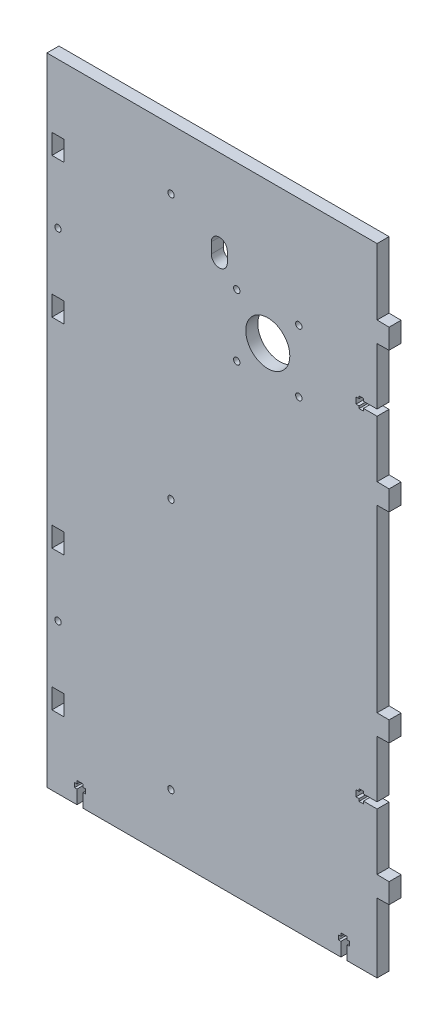
from build123d import *

# Parameters (mm, degrees)
SKETCH_1_R      = 1.6
SKETCH_1_R_2    = 11
SKETCH_1_W      = 6.1
SKETCH_1_H      = 10
EXTRUDE_1_DEPTH = 6


with BuildPart() as part:
    # Эскиз1 → Бобышка-Вытянуть1 (new body)
    with BuildSketch(Plane.XY):
        Polygon((1078.719864828, 623.038519), (1084.719864828, 623.138519), (1084.719864828, 633.138519), (1078.719864828, 633.238519), (1078.719864828, 723.038519), (1084.719864828, 723.138519), (1084.719864828, 733.138519), (1078.719864828, 733.238519), (1078.719864828, 761.588519), (1071.919864828, 761.588519), (1071.919864828, 760.388519), (1069.719864828, 760.388519), (1069.719864828, 761.588519), (1068.219864828, 761.588519), (1068.219864828, 764.688519), (1069.719864828, 764.688519), (1069.719864828, 765.888519), (1071.919864828, 765.888519), (1071.919864828, 764.688519), (1078.719864828, 764.688519), (1078.719864828, 793.038519), (1084.719864828, 793.138519), (1084.719864828, 803.138519), (1078.719864828, 803.238519), (1078.719864828, 836.338519), (978.719864828, 836.338519), (913.719864828, 836.338519), (913.719864828, 518.436195), (928.719864828, 518.436195), (928.719864828, 525.236195), (927.519864828, 525.236195), (927.519864828, 527.436195), (928.719864828, 527.436195), (928.719864828, 528.936195), (931.819864828, 528.936195), (931.819864828, 527.436195), (933.019864828, 527.436195), (933.019864828, 525.236195), (931.819864828, 525.236195), (931.819864828, 518.436195), (978.719864828, 518.436195), (1060.619864828, 518.436195), (1060.619864828, 525.236195), (1059.419864828, 525.236195), (1059.419864828, 527.436195), (1060.619864828, 527.436195), (1060.619864828, 528.936195), (1063.719864828, 528.936195), (1063.719864828, 527.436195), (1064.919864828, 527.436195), (1064.919864828, 525.236195), (1063.719864828, 525.236195), (1063.719864828, 518.436195), (1078.719864828, 518.436195), (1078.719864828, 553.038519), (1084.719864828, 553.138519), (1084.719864828, 563.138519), (1078.719864828, 563.238519), (1078.719864828, 591.588519), (1071.919864828, 591.588519), (1071.919864828, 590.388519), (1069.719864828, 590.388519), (1069.719864828, 591.588519), (1068.219864828, 591.588519), (1068.219864828, 594.688519), (1069.719864828, 594.688519), (1069.719864828, 595.888519), (1071.919864828, 595.888519), (1071.919864828, 594.688519), (1078.719864828, 594.688519), align=None)
        with Locations((919.269864828, 593.238519)):
            Circle(SKETCH_1_R, mode=Mode.SUBTRACT)
        with Locations((919.269864828, 763.238519)):
            Circle(SKETCH_1_R, mode=Mode.SUBTRACT)
        with Locations((975.719864828, 806.338519)):
            Circle(SKETCH_1_R, mode=Mode.SUBTRACT)
        with Locations((975.719864828, 674.138519)):
            Circle(SKETCH_1_R, mode=Mode.SUBTRACT)
        with Locations((975.719864828, 548.438519)):
            Circle(SKETCH_1_R, mode=Mode.SUBTRACT)
        with Locations((1008.611005263, 781.388519)):
            Circle(SKETCH_1_R, mode=Mode.SUBTRACT)
        with Locations((1008.611005263, 750.388519)):
            Circle(SKETCH_1_R, mode=Mode.SUBTRACT)
        with Locations((1024.111005263, 765.888519)):
            Circle(SKETCH_1_R_2, mode=Mode.SUBTRACT)
        with Locations((1039.611005263, 750.388519)):
            Circle(SKETCH_1_R, mode=Mode.SUBTRACT)
        with Locations((1039.611005263, 781.388519)):
            Circle(SKETCH_1_R, mode=Mode.SUBTRACT)
        with BuildLine():
            Line((995.860571369, 795.664930376), (995.860571369, 790.381989897))
            ThreePointArc((995.860571369, 790.381989897), (999.860571369, 786.381989897), (1003.860571369, 790.381989897))
            Line((1003.860571369, 790.381989897), (1003.860571369, 795.664930376))
            ThreePointArc((1003.860571369, 795.664930376), (999.860571369, 799.664930376), (995.860571369, 795.664930376))
        make_face(mode=Mode.SUBTRACT)
        with Locations((919.269864828, 558.238519)):
            Rectangle(SKETCH_1_W, SKETCH_1_H, mode=Mode.SUBTRACT)
        with Locations((919.269864828, 628.238519)):
            Rectangle(SKETCH_1_W, SKETCH_1_H, mode=Mode.SUBTRACT)
        with Locations((919.269864828, 728.238519)):
            Rectangle(SKETCH_1_W, SKETCH_1_H, mode=Mode.SUBTRACT)
        with Locations((919.269864828, 798.238519)):
            Rectangle(SKETCH_1_W, SKETCH_1_H, mode=Mode.SUBTRACT)
    extrude(amount=EXTRUDE_1_DEPTH)


solid = part.part
